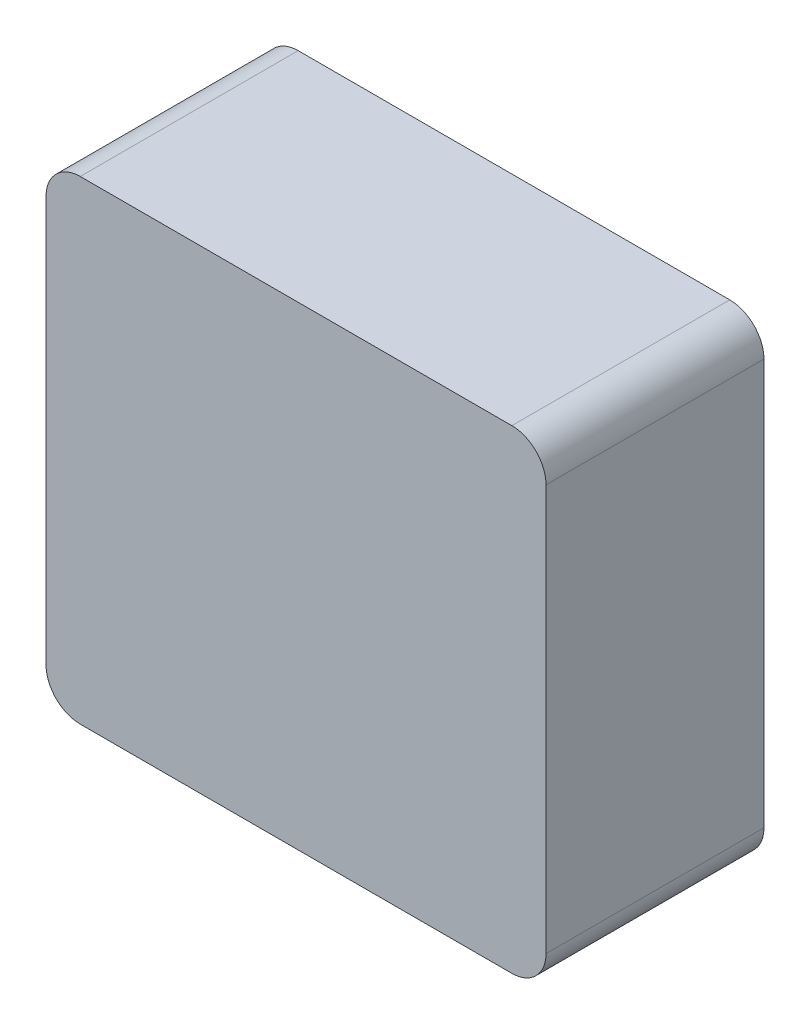
from build123d import *

# Parameters (mm, degrees)
SKETCH_1_W          = 117
SKETCH_1_H          = 111
EXTRUDE_1_DEPTH     = 51
FILLET_1_R          = 8
SKETCH_2_W          = 101
SKETCH_2_H          = 17
CUT_EXTRUDE_1_DEPTH = 0.5
FILLET_2_R          = 45
SKETCH_4_R          = 5
EXTRUDE_3_DEPTH     = 4
EXTRUDE_3_2_DEPTH   = 4
EXTRUDE_3_3_DEPTH   = 4
EXTRUDE_3_4_DEPTH   = 4
SKETCH_5_R          = 3.5
CUT_EXTRUDE_2_DEPTH = 2
SKETCH_6_R          = 1.5
CUT_EXTRUDE_3_DEPTH = 5


with BuildPart() as part:
    # 草图1 → 凸台-拉伸1 (new body)
    with BuildSketch(Plane.XY):
        with Locations((58.5, 55.5)):
            Rectangle(SKETCH_1_W, SKETCH_1_H)
    extrude(amount=EXTRUDE_1_DEPTH)

    # 圆角1
    fillet_1_edges = [part.edges().sort_by_distance(p)[0] for p in [
        (0, 111, 25.5),
        (117, 111, 25.5),
        (117, 0, 25.5),
        (0, 0, 25.5),
    ]]
    fillet(fillet_1_edges, radius=FILLET_1_R)

    # 草图2 → 切除-拉伸1 (cut)
    with BuildSketch(Plane.XZ):
        with Locations((58.5, 28)):
            Rectangle(SKETCH_2_W, SKETCH_2_H)
    extrude(amount=-CUT_EXTRUDE_1_DEPTH, mode=Mode.SUBTRACT)

    # 圆角2
    # the kernel refuses this fillet: 45 mm, written as the material it adds along each edge
    with BuildSketch(Plane(origin=(109, 0.5, 36.5), x_dir=(0, -1, 0), z_dir=(0, 0, -1)), Plane(origin=(8, 0.5, 2.7761398), x_dir=(0, -1, 0), z_dir=(0, 0, 1))) as fillet_2_piece_1:
        with BuildLine():
            CenterArc((45, 6.68954408), FILLET_2_R, 180, 8.549078831)
            Line((0, 6.68954408), (0, 0))
            Line((0, 0), (0.5, 0))
        make_face()
    extrude(amount=33.7238602)

    # 草图6 → 切除-拉伸3 (cut)
    with BuildSketch(Plane(origin=(0, 0, 0), x_dir=(-1, 0, 0), z_dir=(0, 0, -1))):
        with Locations((-58.5, 97.5)):
            Circle(SKETCH_6_R)
        with Locations((-58.5, 13.5)):
            Circle(SKETCH_6_R)
    extrude(amount=-CUT_EXTRUDE_3_DEPTH, mode=Mode.SUBTRACT)


with BuildPart() as body_2:
    # 草图4 → 凸台-拉伸3 (new body)
    with BuildSketch(Plane(origin=(0, 0, 0), x_dir=(-1, 0, 0), z_dir=(0, 0, -1))):
        with Locations((-105.75, 100.5)):
            Circle(SKETCH_4_R)
    extrude(amount=EXTRUDE_3_DEPTH)


with BuildPart() as body_3:
    # 草图4 → Extrude 3 2 (new body)
    with BuildSketch(Plane(origin=(0, 0, 0), x_dir=(-1, 0, 0), z_dir=(0, 0, -1))):
        with Locations((-105.75, 10.5)):
            Circle(SKETCH_4_R)
    extrude(amount=EXTRUDE_3_2_DEPTH)


with BuildPart() as body_4:
    # 草图4 → Extrude 3 3 (new body)
    with BuildSketch(Plane(origin=(0, 0, 0), x_dir=(-1, 0, 0), z_dir=(0, 0, -1))):
        with Locations((-11.25, 10.5)):
            Circle(SKETCH_4_R)
    extrude(amount=EXTRUDE_3_3_DEPTH)


with BuildPart() as body_5:
    # 草图4 → Extrude 3 4 (new body)
    with BuildSketch(Plane(origin=(0, 0, 0), x_dir=(-1, 0, 0), z_dir=(0, 0, -1))):
        with Locations((-11.25, 100.5)):
            Circle(SKETCH_4_R)
    extrude(amount=EXTRUDE_3_4_DEPTH)


with BuildPart() as cut_extrude_2_tool:
    # 草图5 → 切除-拉伸2 (new body)
    with BuildSketch(Plane(origin=(0, 0, -4), x_dir=(-1, 0, 0), z_dir=(0, 0, -1))):
        with Locations((-105.75, 100.5)):
            Circle(SKETCH_5_R)
        with Locations((-105.75, 10.5)):
            Circle(SKETCH_5_R)
        with Locations((-11.25, 10.5)):
            Circle(SKETCH_5_R)
        with Locations((-11.25, 100.5)):
            Circle(SKETCH_5_R)
    extrude(amount=-CUT_EXTRUDE_2_DEPTH)


with BuildPart() as body_2_1:
    add(body_2.part)

    # 切除-拉伸2: cut by cut_extrude_2_tool
    add(cut_extrude_2_tool.part, mode=Mode.SUBTRACT)


with BuildPart() as body_3_1:
    add(body_3.part)

    # 切除-拉伸2: cut by cut_extrude_2_tool
    add(cut_extrude_2_tool.part, mode=Mode.SUBTRACT)


with BuildPart() as body_4_1:
    add(body_4.part)

    # 切除-拉伸2: cut by cut_extrude_2_tool
    add(cut_extrude_2_tool.part, mode=Mode.SUBTRACT)


with BuildPart() as body_5_1:
    add(body_5.part)

    # 切除-拉伸2: cut by cut_extrude_2_tool
    add(cut_extrude_2_tool.part, mode=Mode.SUBTRACT)


solid = Compound([part.part, body_2_1.part, body_3_1.part, body_4_1.part, body_5_1.part])
